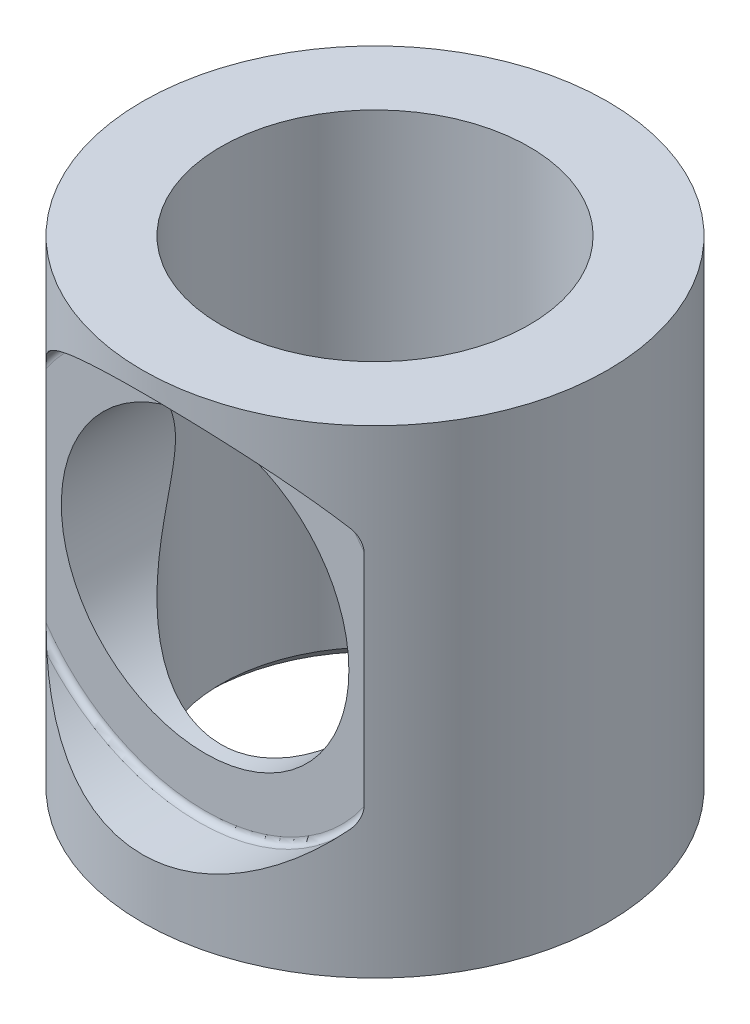
from build123d import *

# Parameters (mm, degrees)
SKETCH1_R               = 8.9
SKETCH1_R_2             = 5.9
BOSS_EXTRUDE1_DEPTH     = 18.3
CUT_EXTRUDE5_START      = 6.5
SKETCH3_R               = 7.65
CUT_EXTRUDE5_DEPTH      = 16.710583063
CUT_EXTRUDE6_DEPTH      = 26.519796404
CUT_EXTRUDE6_DEPTH_BACK = 7
SKETCH6_R               = 5.5
CHAMFER1_SIZE           = 0.5
FILLET1_R               = 0.25


with BuildPart() as part:
    # Sketch1 → Boss-Extrude1 (new body)
    with BuildSketch(Plane(origin=(0, 0, 0), x_dir=(1, 0, 0), z_dir=(0, 1, 0))):
        Circle(SKETCH1_R)
        Circle(SKETCH1_R_2, mode=Mode.SUBTRACT)
    extrude(amount=-BOSS_EXTRUDE1_DEPTH)

    # Sketch3 → Cut-Extrude5 (cut, through all)
    with BuildSketch(Plane.XY.offset(CUT_EXTRUDE5_START)):
        with Locations((0, -8.4)):
            Circle(SKETCH3_R)
    extrude(amount=CUT_EXTRUDE5_DEPTH, mode=Mode.SUBTRACT)

    # Sketch6 → Cut-Extrude6 (cut, two sides: drawn at the far end of the back side and taken through both)
    with BuildSketch(Plane.XY.offset(6.5).offset(-CUT_EXTRUDE6_DEPTH_BACK)):
        with Locations((0, -8.4)):
            Circle(SKETCH6_R)
    extrude(amount=CUT_EXTRUDE6_DEPTH + CUT_EXTRUDE6_DEPTH_BACK, mode=Mode.SUBTRACT)

    # Chamfer1
    chamfer1_edges = [part.edges().sort_by_distance(p)[0] for p in [
        (-5.9, -18.3, 0),
    ]]
    chamfer(chamfer1_edges, length=CHAMFER1_SIZE)

    # Fillet1
    fillet1_edges = [part.edges().sort_by_distance(p)[0] for p in [
        (0, -0.75, 6.5),
        (0, -16.05, 6.5),
    ]]
    fillet(fillet1_edges, radius=FILLET1_R)


solid = part.part
